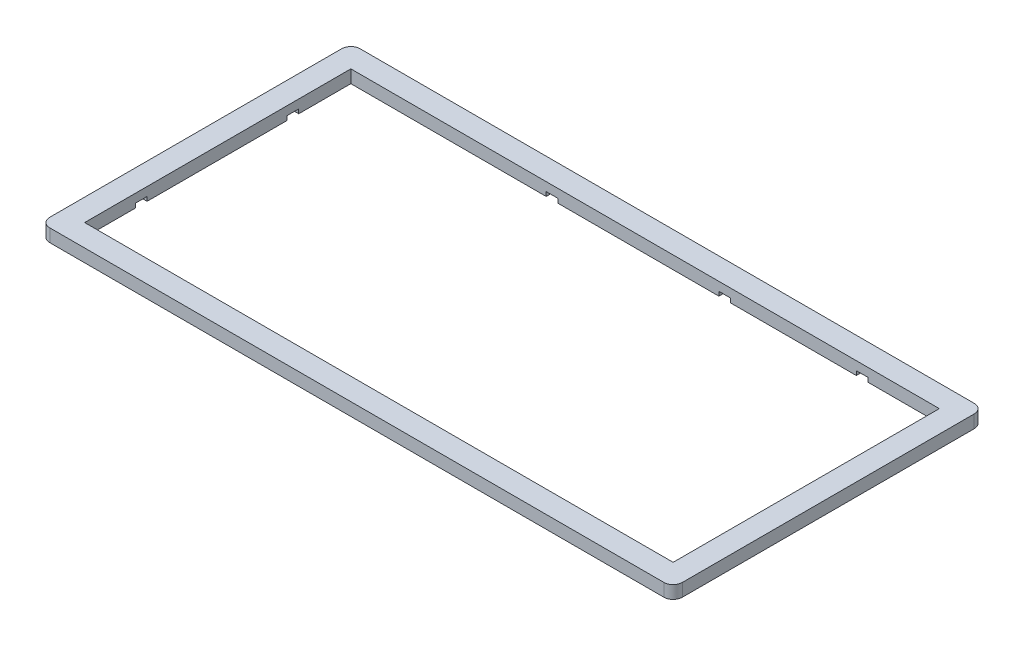
from build123d import *

# Parameters (mm, degrees)
SKETCH1_W           = 344.55
SKETCH1_H           = 169
SKETCH1_W_2         = 320.55
SKETCH1_H_2         = 145
BOSS_EXTRUDE1_DEPTH = 7
FILLET1_R           = 5
FILLET2_R           = 5
FILLET3_R           = 5
CUT_EXTRUDE2_DEPTH  = 2.3
FILLET5_R           = 5
SKETCH4_R           = 1.325
CUT_EXTRUDE3_DEPTH  = 4


with BuildPart() as part:
    # Sketch1 → Boss-Extrude1 (new body)
    with BuildSketch(Plane(origin=(0, 0, 0), x_dir=(1, 0, 0), z_dir=(0, 1, 0))):
        with Locations((0, 6.282475928)):
            Rectangle(SKETCH1_W, SKETCH1_H)
        with Locations((0, 6.282475928)):
            Rectangle(SKETCH1_W_2, SKETCH1_H_2, mode=Mode.SUBTRACT)
    extrude(amount=BOSS_EXTRUDE1_DEPTH)

    # Fillet1
    fillet1_edges = [part.edges().sort_by_distance(p)[0] for p in [
        (172.275, 3.5, 78.217524072),
    ]]
    fillet(fillet1_edges, radius=FILLET1_R)

    # Fillet2
    fillet2_edges = [part.edges().sort_by_distance(p)[0] for p in [
        (-172.275, 3.5, -90.782475928),
    ]]
    fillet(fillet2_edges, radius=FILLET2_R)

    # Fillet3
    fillet3_edges = [part.edges().sort_by_distance(p)[0] for p in [
        (-172.275, 3.5, 78.217524072),
    ]]
    fillet(fillet3_edges, radius=FILLET3_R)

    # Sketch3 → Cut-Extrude2 (cut)
    with BuildSketch(Plane.XZ):
        Polygon((-22.72, -82.082475928), (-47.57, -82.082475928), (-47.57, -78.782475928), (-53.87, -78.782475928), (-53.87, -82.082475928), (-78.72, -82.082475928), (-78.72, -86.582475928), (-22.72, -86.582475928), align=None)
        Polygon((-130.175, 66.217524072), (-123.875, 66.217524072), (-123.875, 69.517524072), (-99.025, 69.517524072), (-99.025, 74.017524072), (-155.025, 74.017524072), (-155.025, 69.517524072), (-130.175, 69.517524072), align=None)
        Polygon((146.225, -82.082475928), (121.375, -82.082475928), (121.375, -78.782475928), (115.075, -78.782475928), (115.075, -82.082475928), (90.225, -82.082475928), (90.225, -86.582475928), (146.225, -86.582475928), align=None)
        Polygon((71.33, -86.582475928), (71.33, -82.082475928), (46.48, -82.082475928), (46.48, -78.782475928), (40.18, -78.782475928), (40.18, -82.082475928), (15.33, -82.082475928), (15.33, -86.582475928), align=None)
        Polygon((-160.275, -44.082475928), (-160.275, -50.382475928), (-163.575, -50.382475928), (-163.575, -75.232475928), (-168.075, -75.232475928), (-168.075, -19.232475928), (-163.575, -19.232475928), (-163.575, -44.082475928), align=None)
        Polygon((163.575, 11.917524072), (163.575, 32.217524072), (160.275, 32.217524072), (160.275, 38.517524072), (163.575, 38.517524072), (163.575, 58.817524072), (168.075, 58.817524072), (168.075, 11.917524072), align=None)
        Polygon((160.275, -40.582475928), (163.575, -40.582475928), (163.575, -15.732475928), (168.075, -15.732475928), (168.075, -71.732475928), (163.575, -71.732475928), (163.575, -46.882475928), (160.275, -46.882475928), align=None)
        Polygon((146.225, 74.017524072), (146.225, 69.517524072), (121.375, 69.517524072), (121.375, 66.217524072), (115.075, 66.217524072), (115.075, 69.517524072), (90.225, 69.517524072), (90.225, 74.017524072), align=None)
        Polygon((15.33, 74.017524072), (71.33, 74.017524072), (71.33, 69.517524072), (46.48, 69.517524072), (46.48, 66.217524072), (40.18, 66.217524072), (40.18, 69.517524072), (15.33, 69.517524072), align=None)
        Polygon((-160.275, 38.517524072), (-160.275, 32.217524072), (-163.575, 32.217524072), (-163.575, 11.917524072), (-168.075, 11.917524072), (-168.075, 58.817524072), (-163.575, 58.817524072), (-163.575, 38.517524072), align=None)
        Polygon((-55.375, 66.217524072), (-49.075, 66.217524072), (-49.075, 69.517524072), (-24.225, 69.517524072), (-24.225, 74.017524072), (-80.225, 74.017524072), (-80.225, 69.517524072), (-55.375, 69.517524072), align=None)
    extrude(amount=-CUT_EXTRUDE2_DEPTH, mode=Mode.SUBTRACT)

    # Fillet5
    fillet5_edges = [part.edges().sort_by_distance(p)[0] for p in [
        (172.275, 3.5, -90.782475928),
    ]]
    fillet(fillet5_edges, radius=FILLET5_R)

    # Sketch4 → Cut-Extrude3 (cut)
    with BuildSketch(Plane.XZ):
        with Locations((-165.542766953, 71.485291024)):
            Circle(SKETCH4_R)
        with Locations((-89.625, 71.767524072)):
            Circle(SKETCH4_R)
        with Locations((80.7775, 71.767524072)):
            Circle(SKETCH4_R)
        with Locations((165.532766953, 71.485291024)):
            Circle(SKETCH4_R)
        with Locations((165.532766953, -84.050242881)):
            Circle(SKETCH4_R)
        with Locations((80.7775, -84.332475928)):
            Circle(SKETCH4_R)
        with Locations((-89.625, -84.050242881)):
            Circle(SKETCH4_R)
        with Locations((-165.542766953, -84.050242881)):
            Circle(SKETCH4_R)
    extrude(amount=-CUT_EXTRUDE3_DEPTH, mode=Mode.SUBTRACT)


solid = part.part
